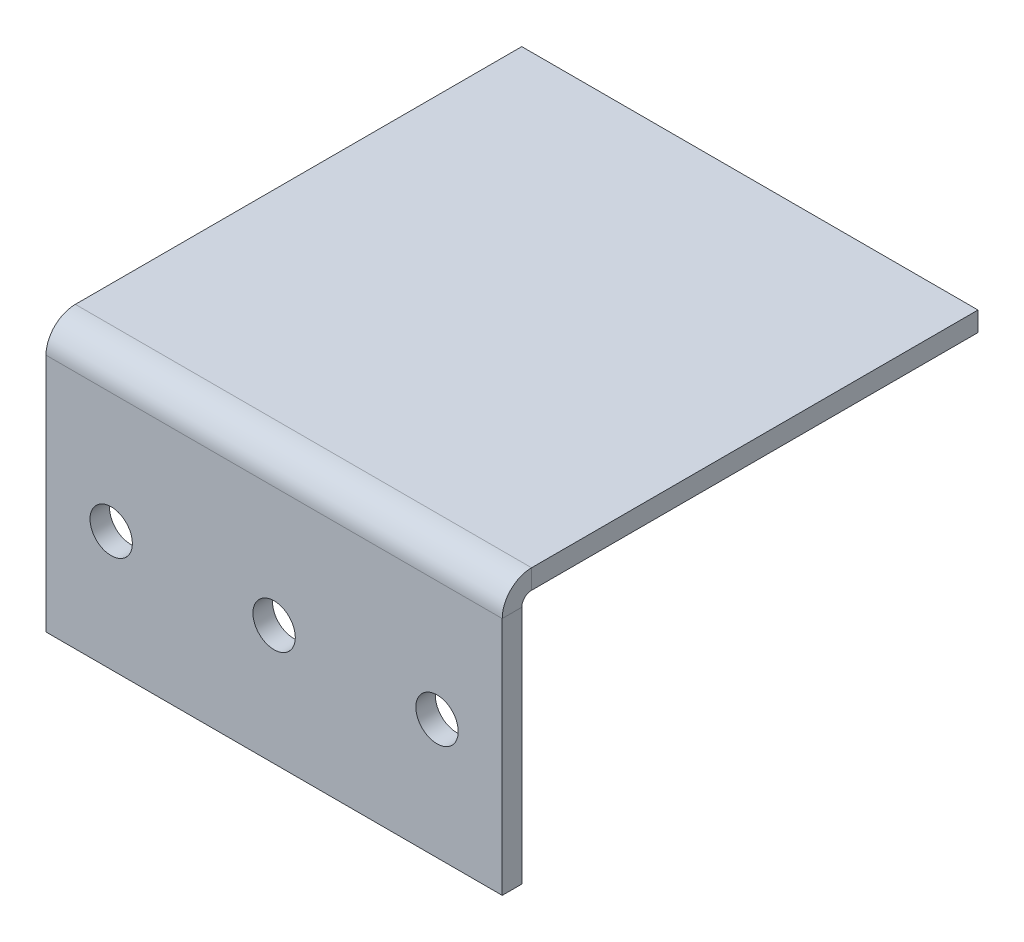
from build123d import *

# Parameters (mm, degrees)
SKETCH_1_W             = 110
SKETCH_1_H             = 3
SM_BASE_FLANGE_1_DEPTH = 35
OTHER_START            = -35
OTHER_1_DEPTH          = 70
OTHER_1_2_DEPTH        = 70
SKETCH_9_R             = 3.25
CUT_EXTRUDE_3_DEPTH    = 90.55412418


# Read off the part's stored shape, not the designer's step: Нарисованный сгиб1
# Sheet-metal steps are written as plain solids
with BuildPart() as part:
    # Sketch 1 → Базовая кромка1 (new, symmetric)
    with BuildSketch(Plane(origin=(0, 0, 0), x_dir=(0, 0, -1), z_dir=(1, 0, 0))):
        with Locations((15, 1.5)):
            Rectangle(SKETCH_1_W, SKETCH_1_H)
    extrude(amount=SM_BASE_FLANGE_1_DEPTH, both=True)

    # Other 1 outline → Other 1 (cut)
    with BuildSketch(Plane.YZ.offset(OTHER_START)):
        with BuildLine():
            Line((0, 40), (0, 2.742640687))
            ThreePointArc((0, 2.742640687), (2.174234614, 1.098076211), (3, -1.5))
            Line((3, -1.5), (3, 40))
            Line((3, 40), (0, 40))
        make_face()
    extrude(amount=OTHER_1_DEPTH, mode=Mode.SUBTRACT)

    # Other 1 2 outline → Other 1 2 (add)
    with BuildSketch(Plane.YZ.offset(OTHER_START)):
        with BuildLine():
            Line((-1.5, 3), (-38.28761102, 3))
            Line((-38.28761102, 3), (-38.28761102, 0))
            Line((-38.28761102, 0), (-1.5, 0))
            ThreePointArc((-1.5, 0), (-0.439339828, -0.439339828), (0, -1.5))
            Line((0, -1.5), (0, 2.742640687))
            ThreePointArc((0, 2.742640687), (-0.739041096, 2.935193518), (-1.5, 3))
        make_face()
    extrude(amount=OTHER_1_2_DEPTH)

    # Эскиз9 → Вырез-Вытянуть3 (cut, through all)
    with BuildSketch(Plane.XY.offset(3)):
        with Locations((-25, -19.89380551)):
            Circle(SKETCH_9_R)
        with Locations((0, -19.89380551)):
            Circle(SKETCH_9_R)
        with Locations((25, -19.89380551)):
            Circle(SKETCH_9_R)
    extrude(amount=-CUT_EXTRUDE_3_DEPTH, mode=Mode.SUBTRACT)


solid = part.part
